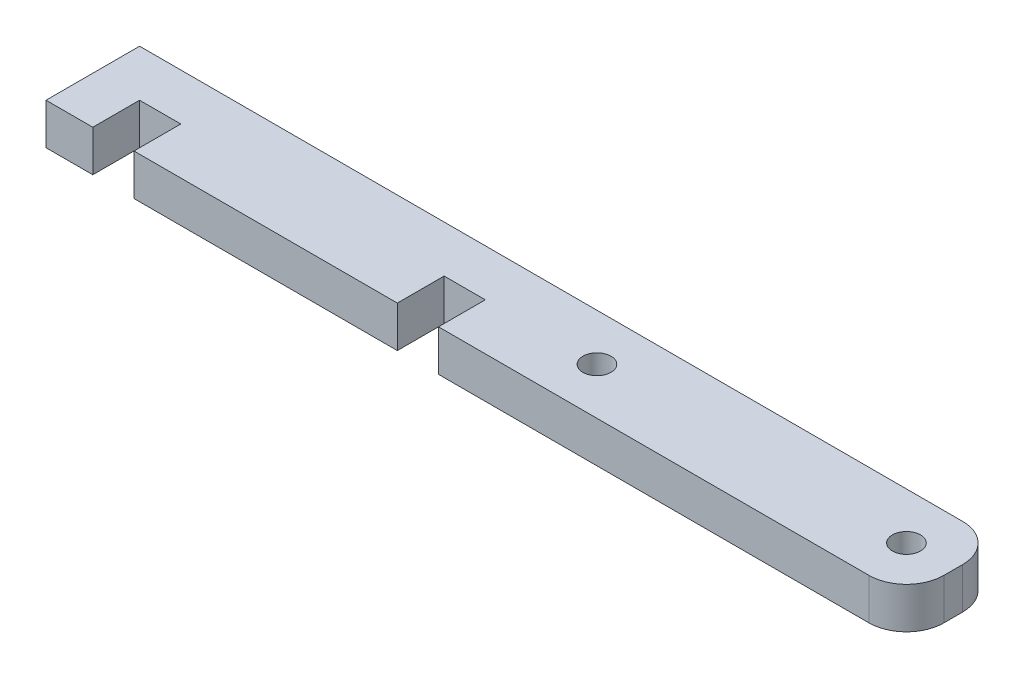
from build123d import *

# Parameters (mm, degrees)
BOSS_EXTRUDE1_DEPTH = 2.794
SKETCH2_R           = 0.9525
CUT_EXTRUDE1_DEPTH  = 59.792605897
FILLET2_R           = 2.54


with BuildPart() as part:
    # Sketch1 → Boss-Extrude1 (new body)
    with BuildSketch(Plane(origin=(0, 0, 0), x_dir=(1, 0, 0), z_dir=(0, 1, 0))):
        Polygon((0, 0), (3.175, 0), (3.175, 3.175), (5.969, 3.175), (5.969, 0), (23.837859958, 0), (23.837859958, 3.175), (26.631859958, 3.175), (26.631859958, 0), (58.381859958, 0), (58.381859958, 6.35), (0, 6.35), align=None)
    extrude(amount=BOSS_EXTRUDE1_DEPTH)

    # Sketch2 → Cut-Extrude1 (cut, through all)
    with BuildSketch(Plane(origin=(0, 2.794, 0), x_dir=(1, 0, 0), z_dir=(0, 1, 0))):
        with Locations((55.206859958, 3.175)):
            Circle(SKETCH2_R)
        with Locations((34.206859958, 3.175)):
            Circle(SKETCH2_R)
    extrude(amount=-CUT_EXTRUDE1_DEPTH, mode=Mode.SUBTRACT)

    # Fillet2
    fillet2_edges = [part.edges().sort_by_distance(p)[0] for p in [
        (58.381859958, 1.397, 0),
        (58.381859958, 1.397, -6.35),
    ]]
    fillet(fillet2_edges, radius=FILLET2_R)


solid = part.part
